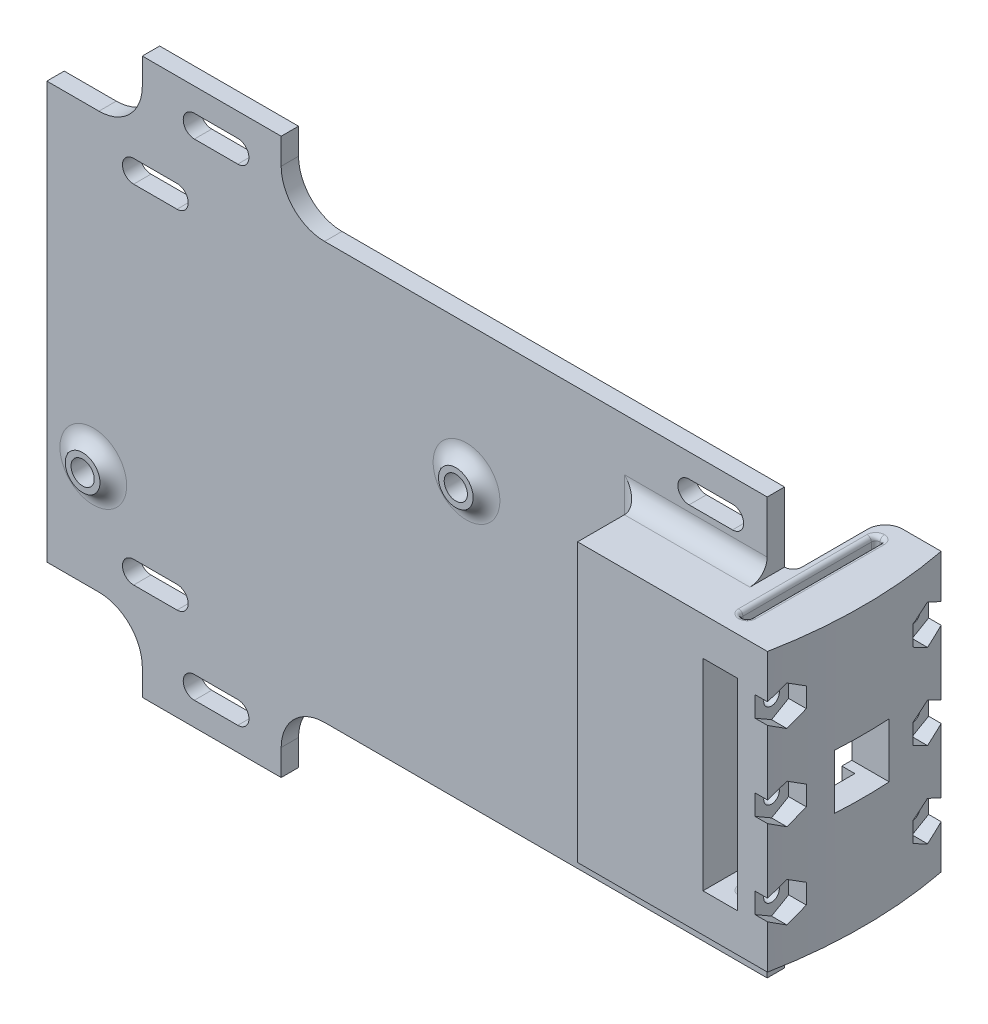
from build123d import *

# Parameters (mm, degrees)
SKETCH1_W                  = 105.41
SKETCH1_H                  = 60.96
BOSS_EXTRUDE1_DEPTH        = 2.54
SKETCH20_W                 = 20.32
SKETCH20_H                 = 2.54
BOSS_EXTRUDE5_DEPTH        = 10.16
SKETCH21_W                 = 20.32
SKETCH21_H                 = 2.54
BOSS_EXTRUDE6_DEPTH        = 10.16
SKETCH3_W                  = 18.34896
SKETCH3_H                  = 40.64
BOSS_EXTRUDE2_DEPTH        = 9.398
SKETCH4_W                  = 2.1209
SKETCH4_H                  = 24.00046
SD_CARD_SLOT_DEPTH         = 16.51
MOUNTING_SLOTS_REACH       = 69.616
SKETCH8_W                  = 25.4
SKETCH8_H                  = 40.64
CAMERA_MOUNT_DEPTH         = 38.1
CUT_EXTRUDE7_DEPTH         = 117.124191575
CUT_EXTRUDE7_DEPTH_BACK    = 117.124191575
SKETCH10_W                 = 254
SKETCH10_H                 = 254
SKETCH10_R                 = 66.675
CUT_EXTRUDE8_DEPTH         = 77.966296085
CUT_EXTRUDE8_DEPTH_BACK    = 73.902296085
CUT_EXTRUDE8_START         = -4.064
SKETCH9_W                  = 5.08
SKETCH9_H                  = 29.464
SKETCH11_R                 = 1.143
SKETCH11_W                 = 8.001
SKETCH11_H                 = 8.001
CAMERA_HOLES_DEPTH         = 119.494198778
M2_5_CAMERA_NUT_REACH      = 123.034
M2_5_CAMERA_NUT_END_RADIUS = 66.675
M2_5_START                 = -2.54
SKETCH6_R                  = 2.54
BOSS_EXTRUDE4_DEPTH        = 1.5621
SKETCH18_R                 = 1.4605
CUT_EXTRUDE13_DEPTH        = 78.306172702
HEX_HOLES_DEPTH            = 1.27
M3_CLEARANCE_HOLE1_D       = 3.4
M3_CLEARANCE_HOLE1_DEPTH   = 9.99998
M3_CLEARANCE_HOLE1_TIP     = 1.021463052
SKETCH32_W                 = 5.08
SKETCH32_H                 = 29.464
CUT_EXTRUDE14_DEPTH        = 1.905
SKETCH33_W                 = 1.27
SKETCH33_H                 = 20.066
CUT_EXTRUDE15_DEPTH        = 89.957766232
SKETCH34_W                 = 1.27
SKETCH34_H                 = 28.523215287
CUT_EXTRUDE16_DEPTH        = 89.957766232
FILLET4_R                  = 0.635
FILLET1_R                  = 2.54
FILLET2_R                  = 2.54
FILLET3_R                  = 6.35
FILLET5_R                  = 1.27
FILLET6_R                  = 2.54


# Some blends are built 0.0001 mm under size
with BuildPart() as part:
    # Sketch1 → Boss-Extrude1 (new body)
    with BuildSketch(Plane.XY):
        Rectangle(SKETCH1_W, SKETCH1_H)
    extrude(amount=BOSS_EXTRUDE1_DEPTH)

    # Sketch20 → Boss-Extrude5 (add)
    with BuildSketch(Plane(origin=(0, 30.48, 0), x_dir=(1, 0, 0), z_dir=(0, 1, 0))):
        with Locations((-28.575, -1.27)):
            Rectangle(SKETCH20_W, SKETCH20_H)
    extrude(amount=BOSS_EXTRUDE5_DEPTH)

    # Sketch21 → Boss-Extrude6 (add)
    with BuildSketch(Plane(origin=(0, -30.48, 0), x_dir=(-1, 0, 0), z_dir=(0, -1, 0))):
        with Locations((28.575, -1.27)):
            Rectangle(SKETCH21_W, SKETCH21_H)
    extrude(amount=BOSS_EXTRUDE6_DEPTH)

    # Sketch3 → Boss-Extrude2 (add)
    with BuildSketch(Plane.XY.offset(2.54)):
        with Locations((43.53052, 0)):
            Rectangle(SKETCH3_W, SKETCH3_H)
    extrude(amount=BOSS_EXTRUDE2_DEPTH)

    # Sketch4 → SD card Slot (cut)
    with BuildSketch(Plane.ZY.offset(-34.35604)):
        with Locations((9.95045, -0.57023)):
            Rectangle(SKETCH4_W, SKETCH4_H)
    extrude(amount=-SD_CARD_SLOT_DEPTH, mode=Mode.SUBTRACT)

    # Sketch5 → Mounting slots (cut, up to next)
    with BuildSketch(Plane(origin=(0, 0, 0), x_dir=(-1, 0, 0), z_dir=(0, 0, -1)), mode=Mode.PRIVATE) as mounting_slots_sk1:
        with BuildLine():
            Line((24.765, 37.19195), (31.115, 37.19195))
            ThreePointArc((31.115, 37.19195), (32.74695, 35.56), (31.115, 33.92805))
            Line((31.115, 33.92805), (24.765, 33.92805))
            ThreePointArc((24.765, 33.92805), (23.13305, 35.56), (24.765, 37.19195))
        make_face()
    mounting_slots_tool1 = extrude(mounting_slots_sk1.sketch, amount=-MOUNTING_SLOTS_REACH, mode=Mode.PRIVATE) & part.part
    # Sketch5 → Mounting slots (cut, up to next)
    with BuildSketch(Plane(origin=(0, 0, 0), x_dir=(-1, 0, 0), z_dir=(0, 0, -1)), mode=Mode.PRIVATE) as mounting_slots_sk2:
        with BuildLine():
            Line((-47.625, -23.76805), (-41.275, -23.76805))
            ThreePointArc((-41.275, -23.76805), (-39.64305, -25.4), (-41.275, -27.03195))
            Line((-41.275, -27.03195), (-47.625, -27.03195))
            ThreePointArc((-47.625, -27.03195), (-49.25695, -25.4), (-47.625, -23.76805))
        make_face()
    mounting_slots_tool2 = extrude(mounting_slots_sk2.sketch, amount=-MOUNTING_SLOTS_REACH, mode=Mode.PRIVATE) & part.part
    # Sketch5 → Mounting slots (cut, up to next)
    with BuildSketch(Plane(origin=(0, 0, 0), x_dir=(-1, 0, 0), z_dir=(0, 0, -1)), mode=Mode.PRIVATE) as mounting_slots_sk3:
        with BuildLine():
            Line((33.655, -23.76805), (40.005, -23.76805))
            ThreePointArc((40.005, -23.76805), (41.63695, -25.4), (40.005, -27.03195))
            Line((40.005, -27.03195), (33.655, -27.03195))
            ThreePointArc((33.655, -27.03195), (32.02305, -25.4), (33.655, -23.76805))
        make_face()
    mounting_slots_tool3 = extrude(mounting_slots_sk3.sketch, amount=-MOUNTING_SLOTS_REACH, mode=Mode.PRIVATE) & part.part
    # Sketch5 → Mounting slots (cut, up to next)
    with BuildSketch(Plane(origin=(0, 0, 0), x_dir=(-1, 0, 0), z_dir=(0, 0, -1)), mode=Mode.PRIVATE) as mounting_slots_sk4:
        with BuildLine():
            Line((33.655, 27.03195), (40.005, 27.03195))
            ThreePointArc((40.005, 27.03195), (41.63695, 25.4), (40.005, 23.76805))
            Line((40.005, 23.76805), (33.655, 23.76805))
            ThreePointArc((33.655, 23.76805), (32.02305, 25.4), (33.655, 27.03195))
        make_face()
    mounting_slots_tool4 = extrude(mounting_slots_sk4.sketch, amount=-MOUNTING_SLOTS_REACH, mode=Mode.PRIVATE) & part.part
    # Sketch5 → Mounting slots (cut, up to next)
    with BuildSketch(Plane(origin=(0, 0, 0), x_dir=(-1, 0, 0), z_dir=(0, 0, -1)), mode=Mode.PRIVATE) as mounting_slots_sk5:
        with BuildLine():
            Line((-47.625, 27.03195), (-41.275, 27.03195))
            ThreePointArc((-41.275, 27.03195), (-39.64305, 25.4), (-41.275, 23.76805))
            Line((-41.275, 23.76805), (-47.625, 23.76805))
            ThreePointArc((-47.625, 23.76805), (-49.25695, 25.4), (-47.625, 27.03195))
        make_face()
    mounting_slots_tool5 = extrude(mounting_slots_sk5.sketch, amount=-MOUNTING_SLOTS_REACH, mode=Mode.PRIVATE) & part.part
    # Sketch5 → Mounting slots (cut, up to next)
    with BuildSketch(Plane(origin=(0, 0, 0), x_dir=(-1, 0, 0), z_dir=(0, 0, -1)), mode=Mode.PRIVATE) as mounting_slots_sk6:
        with BuildLine():
            Line((24.765, -37.19195), (31.115, -37.19195))
            ThreePointArc((31.115, -37.19195), (32.74695, -35.56), (31.115, -33.92805))
            Line((31.115, -33.92805), (24.765, -33.92805))
            ThreePointArc((24.765, -33.92805), (23.13305, -35.56), (24.765, -37.19195))
        make_face()
    mounting_slots_tool6 = extrude(mounting_slots_sk6.sketch, amount=-MOUNTING_SLOTS_REACH, mode=Mode.PRIVATE) & part.part
    add(mounting_slots_tool1.solids().sort_by_distance((-27.94, 35.56, 0))[0], mode=Mode.SUBTRACT)
    add(mounting_slots_tool2.solids().sort_by_distance((44.45, -25.4, 0))[0], mode=Mode.SUBTRACT)
    add(mounting_slots_tool3.solids().sort_by_distance((-36.83, -25.4, 0))[0], mode=Mode.SUBTRACT)
    add(mounting_slots_tool4.solids().sort_by_distance((-36.83, 25.4, 0))[0], mode=Mode.SUBTRACT)
    add(mounting_slots_tool5.solids().sort_by_distance((44.45, 25.4, 0))[0], mode=Mode.SUBTRACT)
    add(mounting_slots_tool6.solids().sort_by_distance((-27.94, -35.56, 0))[0], mode=Mode.SUBTRACT)

    # Sketch8 → Camera Mount (add)
    with BuildSketch(Plane(origin=(52.705, 0, 0), x_dir=(0, 0, -1), z_dir=(1, 0, 0))):
        with Locations((0.762, 0)):
            Rectangle(SKETCH8_W, SKETCH8_H)
    extrude(amount=CAMERA_MOUNT_DEPTH)

    # Sketch10 → Cut-Extrude7 (cut, two sides: drawn at the far end of the back side and taken through both)
    with BuildSketch(Plane(origin=(0, 30.48, 0), x_dir=(1, 0, 0), z_dir=(0, 1, 0)).offset(-CUT_EXTRUDE7_DEPTH_BACK)):
        with Locations((2.821418608, -6.153022645)):
            Rectangle(SKETCH10_W, SKETCH10_H)
        with Locations((-3.302, 0.8001)):
            Circle(SKETCH10_R, mode=Mode.SUBTRACT)
    extrude(amount=CUT_EXTRUDE7_DEPTH + CUT_EXTRUDE7_DEPTH_BACK, mode=Mode.SUBTRACT)

    # Sketch9 → Cut-Extrude8 (cut, two sides: drawn at the far end of the back side and taken through both)
    with BuildSketch(Plane.XY.offset(2.54).offset(CUT_EXTRUDE8_START - CUT_EXTRUDE8_DEPTH_BACK)):
        with Locations((55.245, 0)):
            Rectangle(SKETCH9_W, SKETCH9_H)
    extrude(amount=CUT_EXTRUDE8_DEPTH + CUT_EXTRUDE8_DEPTH_BACK, mode=Mode.SUBTRACT)

    # Sketch11 → Camera holes (cut, through all)
    with BuildSketch(Plane.ZY.offset(-57.785)):
        with Locations((9.525, 0)):
            Circle(SKETCH11_R)
        with Locations((-11.049, 0)):
            Circle(SKETCH11_R)
        with Locations((-11.049, 12.446)):
            Circle(SKETCH11_R)
        with Locations((9.525, 12.446)):
            Circle(SKETCH11_R)
        with Locations((-11.049, -12.446)):
            Circle(SKETCH11_R)
        with Locations((9.525, -12.446)):
            Circle(SKETCH11_R)
        with Locations((-0.762, 0)):
            Rectangle(SKETCH11_W, SKETCH11_H)
    extrude(amount=-CAMERA_HOLES_DEPTH, mode=Mode.SUBTRACT)

    # M2.5 camera nut: up to this cylinder (the profile starts inside it)
    m2_5_camera_nut_end = Plane(origin=(-3.302, 0, -0.8001), z_dir=(0, 1, 0)) * Cylinder(M2_5_CAMERA_NUT_END_RADIUS, 405.31, mode=Mode.PRIVATE)
    # Sketch15 → M2.5 camera nut (cut, up to the surface)
    with BuildSketch(Plane.ZY.offset(-57.785).offset(M2_5_START), mode=Mode.PRIVATE) as m2_5_camera_nut_sk1:
        Polygon((7.025005, 11.002627214), (9.525, 9.559254428), (12.024995, 11.002627214), (12.024995, 13.889372786), (9.525, 15.332745572), (7.025005, 13.889372786), align=None)
    m2_5_camera_nut_tool1 = extrude(m2_5_camera_nut_sk1.sketch, amount=-M2_5_CAMERA_NUT_REACH, mode=Mode.PRIVATE) & m2_5_camera_nut_end
    add(m2_5_camera_nut_tool1.solids().sort_by_distance((60.325, 12.446, 9.525))[0], mode=Mode.SUBTRACT)
    # Sketch15 → M2.5 camera nut (cut, up to the surface)
    with BuildSketch(Plane.ZY.offset(-57.785).offset(M2_5_START), mode=Mode.PRIVATE) as m2_5_camera_nut_sk2:
        Polygon((-8.549005, 11.002627214), (-8.549005, 13.889372786), (-11.049, 15.332745572), (-13.548995, 13.889372786), (-13.548995, 11.002627214), (-11.049, 9.559254428), align=None)
    m2_5_camera_nut_tool2 = extrude(m2_5_camera_nut_sk2.sketch, amount=-M2_5_CAMERA_NUT_REACH, mode=Mode.PRIVATE) & m2_5_camera_nut_end
    add(m2_5_camera_nut_tool2.solids().sort_by_distance((60.325, 12.446, -11.049))[0], mode=Mode.SUBTRACT)
    # Sketch15 → M2.5 camera nut (cut, up to the surface)
    with BuildSketch(Plane.ZY.offset(-57.785).offset(M2_5_START), mode=Mode.PRIVATE) as m2_5_camera_nut_sk3:
        Polygon((7.025005, -1.443372786), (9.525, -2.886745572), (12.024995, -1.443372786), (12.024995, 1.443372786), (9.525, 2.886745572), (7.025005, 1.443372786), align=None)
    m2_5_camera_nut_tool3 = extrude(m2_5_camera_nut_sk3.sketch, amount=-M2_5_CAMERA_NUT_REACH, mode=Mode.PRIVATE) & m2_5_camera_nut_end
    add(m2_5_camera_nut_tool3.solids().sort_by_distance((60.325, 0, 9.525))[0], mode=Mode.SUBTRACT)
    # Sketch15 → M2.5 camera nut (cut, up to the surface)
    with BuildSketch(Plane.ZY.offset(-57.785).offset(M2_5_START), mode=Mode.PRIVATE) as m2_5_camera_nut_sk4:
        Polygon((7.025005, -13.889372786), (9.525, -15.332745572), (12.024995, -13.889372786), (12.024995, -11.002627214), (9.525, -9.559254428), (7.025005, -11.002627214), align=None)
    m2_5_camera_nut_tool4 = extrude(m2_5_camera_nut_sk4.sketch, amount=-M2_5_CAMERA_NUT_REACH, mode=Mode.PRIVATE) & m2_5_camera_nut_end
    add(m2_5_camera_nut_tool4.solids().sort_by_distance((60.325, -12.446, 9.525))[0], mode=Mode.SUBTRACT)
    # Sketch15 → M2.5 camera nut (cut, up to the surface)
    with BuildSketch(Plane.ZY.offset(-57.785).offset(M2_5_START), mode=Mode.PRIVATE) as m2_5_camera_nut_sk5:
        Polygon((-13.548995, -1.443372786), (-11.049, -2.886745572), (-8.549005, -1.443372786), (-8.549005, 1.443372786), (-11.049, 2.886745572), (-13.548995, 1.443372786), align=None)
    m2_5_camera_nut_tool5 = extrude(m2_5_camera_nut_sk5.sketch, amount=-M2_5_CAMERA_NUT_REACH, mode=Mode.PRIVATE) & m2_5_camera_nut_end
    add(m2_5_camera_nut_tool5.solids().sort_by_distance((60.325, 0, -11.049))[0], mode=Mode.SUBTRACT)
    # Sketch15 → M2.5 camera nut (cut, up to the surface)
    with BuildSketch(Plane.ZY.offset(-57.785).offset(M2_5_START), mode=Mode.PRIVATE) as m2_5_camera_nut_sk6:
        Polygon((-13.548995, -13.889372786), (-11.049, -15.332745572), (-8.549005, -13.889372786), (-8.549005, -11.002627214), (-11.049, -9.559254428), (-13.548995, -11.002627214), align=None)
    m2_5_camera_nut_tool6 = extrude(m2_5_camera_nut_sk6.sketch, amount=-M2_5_CAMERA_NUT_REACH, mode=Mode.PRIVATE) & m2_5_camera_nut_end
    add(m2_5_camera_nut_tool6.solids().sort_by_distance((60.325, -12.446, -11.049))[0], mode=Mode.SUBTRACT)

    # Sketch6 → Boss-Extrude4 (add)
    with BuildSketch(Plane.XY.offset(2.54)):
        with Locations(Location((-45.90796, -14.953996, 0), (0, 0, 180))):
            Circle(SKETCH6_R)
        with Locations(Location((8.70204, 10.446004, 0), (0, 0, 180))):
            Circle(SKETCH6_R)
    extrude(amount=BOSS_EXTRUDE4_DEPTH)

    # Sketch18 → Cut-Extrude13 (cut, through all)
    with BuildSketch(Plane.XY.offset(4.1021)):
        with Locations((8.70204, 10.446004)):
            Circle(SKETCH18_R)
        with Locations((-45.90796, -14.953996)):
            Circle(SKETCH18_R)
    extrude(amount=-CUT_EXTRUDE13_DEPTH, mode=Mode.SUBTRACT)

    # Sketch29 → hex holes (cut)
    with BuildSketch(Plane(origin=(0, 0, 0), x_dir=(-1, 0, 0), z_dir=(0, 0, -1))):
        Polygon((47.495670065, -17.7039905), (49.08338013, -14.953996), (47.495670065, -12.2040015), (44.320249935, -12.2040015), (42.73253987, -14.953996), (44.320249935, -17.7039905), align=None)
        Polygon((-5.52661987, 10.446004), (-7.114329935, 13.1959985), (-10.289750065, 13.1959985), (-11.87746013, 10.446004), (-10.289750065, 7.6960095), (-7.114329935, 7.6960095), align=None)
    extrude(amount=-HEX_HOLES_DEPTH, mode=Mode.SUBTRACT)

    # M3 Clearance Hole1
    with Locations(Plane(origin=(0, 0, 0), x_dir=(-1, 0, 0), z_dir=(0, 0, -1))):
        with Locations((45.90796, -14.953996), (-8.70204, 10.446004)):
            Hole(M3_CLEARANCE_HOLE1_D / 2, depth=M3_CLEARANCE_HOLE1_DEPTH)
            with Locations((0, 0, -(M3_CLEARANCE_HOLE1_DEPTH + M3_CLEARANCE_HOLE1_TIP / 2))):  # 118° drill point
                Cone(0, M3_CLEARANCE_HOLE1_D / 2, M3_CLEARANCE_HOLE1_TIP, mode=Mode.SUBTRACT)

    # Sketch32 → Cut-Extrude14 (cut)
    with BuildSketch(Plane.ZY.offset(-57.785)):
        with Locations((-0.762, 0)):
            Rectangle(SKETCH32_W, SKETCH32_H)
    extrude(amount=-CUT_EXTRUDE14_DEPTH, mode=Mode.SUBTRACT)

    # Sketch33 → Cut-Extrude15 (cut, through all)
    with BuildSketch(Plane(origin=(0, 20.32, 0), x_dir=(1, 0, 0), z_dir=(0, 1, 0))):
        with Locations((55.88, 0.762)):
            Rectangle(SKETCH33_W, SKETCH33_H)
    extrude(amount=-CUT_EXTRUDE15_DEPTH, mode=Mode.SUBTRACT)

    # Sketch34 → Cut-Extrude16 (cut, through all)
    with BuildSketch(Plane(origin=(0, 20.32, 0), x_dir=(1, 0, 0), z_dir=(0, 1, 0))):
        with Locations((53.34, 14.261607644)):
            Rectangle(SKETCH34_W, SKETCH34_H)
    extrude(amount=-CUT_EXTRUDE16_DEPTH, mode=Mode.SUBTRACT)

    # Fillet4
    fillet4_edges = [part.edges().sort_by_distance(p)[0] for p in [
        (56.515, 17.526, -10.795),
        (56.515, 17.526, 9.271),
        (56.515, -17.526, 9.271),
        (55.245, -17.526, 9.271),
        (55.245, -17.526, -10.795),
        (56.515, -17.526, -10.795),
        (55.245, 17.526, -10.795),
        (55.245, 17.526, 9.271),
    ]]
    fillet(fillet4_edges, radius=FILLET4_R - 0.0001)  # a hair under: the kernel refuses the full size
    fillet4_2_edges = [part.edges().sort_by_distance(p)[0] for p in [
        (55.245, 20.32, -0.762),
        (55.245, 14.732, -0.762),
        (55.245, -20.32, -0.762),
        (56.515, -20.32, -0.762),
        (56.515, -14.732, -0.762),
        (55.245, -14.732, -0.762),
        (56.515, 20.32, -0.762),
        (56.515, 14.732, -0.762),
        (56.329042095, 14.732, -10.609042095),
        (56.329042095, 14.732, 9.085042095),
        (56.329042095, 20.32, -10.609042095),
        (56.329042095, 20.32, 9.085042095),
        (55.430957905, -14.732, -10.609042095),
        (55.430957905, -14.732, 9.085042095),
        (56.329042095, -14.732, 9.085042095),
        (56.329042095, -14.732, -10.609042095),
        (56.329042095, -20.32, 9.085042095),
        (56.329042095, -20.32, -10.609042095),
        (55.430957905, -20.32, -10.609042095),
        (55.430957905, -20.32, 9.085042095),
        (55.430957905, 14.732, 9.085042095),
        (55.430957905, 14.732, -10.609042095),
        (55.430957905, 20.32, 9.085042095),
        (55.430957905, 20.32, -10.609042095),
    ]]
    fillet(fillet4_2_edges, radius=FILLET4_R)

    # Fillet1
    # the kernel refuses this fillet: 2.54 mm, written as the material it adds along each edge
    with BuildSketch(Plane(origin=(-45.90796, -14.953996, 2.54), x_dir=(-1, 0, 0), z_dir=(0, 1, 0))) as fillet1_piece_1:
        with BuildLine():
            CenterArc((4.884208094, 2.54), FILLET1_R, 202.643740263, 67.356259737)
            Line((2.54, 1.5621), (2.493115838, 1.542542))
            ThreePointArc((2.493115838, 1.542542), (2.4892, 0.78105), (2.4892, 0))
            Line((2.4892, 0), (2.54, -0.0508))
            Line((2.54, -0.0508), (4.884208094, -0.0508))
            Line((4.884208094, -0.0508), (4.884208094, 0))
        make_face()
    revolve(axis=Axis((-45.90796, -14.953996, 2.54), (0, 0, 1)))
    with BuildSketch(Plane(origin=(8.70204, 10.446004, 2.54), x_dir=(-1, 0, 0), z_dir=(0, 1, 0))) as fillet1_piece_2:
        with BuildLine():
            CenterArc((4.884208094, 2.54), FILLET1_R, 202.643740263, 67.356259737)
            Line((2.54, 1.5621), (2.493115838, 1.542542))
            ThreePointArc((2.493115838, 1.542542), (2.4892, 0.78105), (2.4892, 0))
            Line((2.4892, 0), (2.54, -0.0508))
            Line((2.54, -0.0508), (4.884208094, -0.0508))
            Line((4.884208094, -0.0508), (4.884208094, 0))
        make_face()
    revolve(axis=Axis((8.70204, 10.446004, 2.54), (0, 0, 1)))

    # Fillet2
    fillet2_edges = [part.edges().sort_by_distance(p)[0] for p in [
        (43.53052, -20.32, 2.54),
        (34.35604, 0, 2.54),
        (43.53052, 20.32, 2.54),
    ]]
    fillet(fillet2_edges, radius=FILLET2_R)

    # Fillet3
    fillet3_edges = [part.edges().sort_by_distance(p)[0] for p in [
        (-18.415, 30.48, 1.27),
        (-38.735, 30.48, 1.27),
        (-18.415, -30.48, 1.27),
        (-38.735, -30.48, 1.27),
    ]]
    fillet(fillet3_edges, radius=FILLET3_R)

    # Fillet5
    fillet5_edges = [part.edges().sort_by_distance(p)[0] for p in [
        (53.975, -17.526, 0),
        (53.975, 17.526, 0),
    ]]
    fillet(fillet5_edges, radius=FILLET5_R)

    # Fillet6
    fillet6_edges = [part.edges().sort_by_distance(p)[0] for p in [
        (53.975, 17.526, -13.462),
        (53.975, -17.526, -13.462),
    ]]
    fillet(fillet6_edges, radius=FILLET6_R)


solid = part.part
